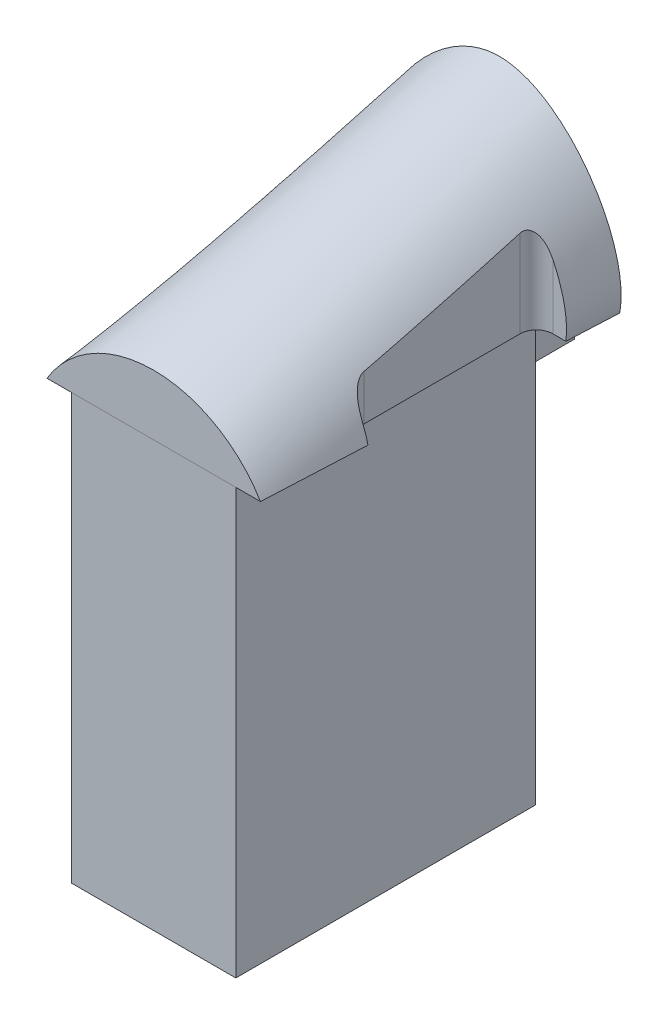
from build123d import *

# Parameters (mm, degrees)
SKETCH_1_W          = 40
SKETCH_1_H          = 73
EXTRUDE_1_DEPTH     = 51.75
SKETCH_2_W          = 26.5
SKETCH_2_H          = 11
EXTRUDE_2_DEPTH     = 10.5
CUT_EXTRUDE_1_DEPTH = 118.658825115


with BuildPart() as part:
    # 草图1 → 凸台-拉伸1 (new, symmetric)
    with BuildSketch(Plane(origin=(0, 0, 0), x_dir=(1, 0, 0), z_dir=(0, 1, 0))):
        Rectangle(SKETCH_1_W, SKETCH_1_H)
    extrude(amount=EXTRUDE_1_DEPTH, both=True)

    # 草图2 → 凸台-拉伸2 (add)
    with BuildSketch(Plane(origin=(0, 0, -36.5), x_dir=(-1, 0, 0), z_dir=(0, 0, -1))):
        with Locations((-5.75, 46.25)):
            Rectangle(SKETCH_2_W, SKETCH_2_H)
    extrude(amount=EXTRUDE_2_DEPTH)


with BuildPart() as body_2:
    # 草图3 → 放样1 section 0
    with BuildSketch(Plane(origin=(0, 0, -47), x_dir=(-1, 0, 0), z_dir=(0, 0, -1))):
        with BuildLine():
            Line((-30, 51.75), (30, 51.75))
            add(Edge.make_bspline(
                [(-30, 51.75), (-32.960840364, 67.552970125), (-0.122307099, 116.257852524), (33.072086404, 64.936710937), (30, 51.75)],
                knots=[0, 0, 0, 0, 0.500504929, 1, 1, 1, 1], degree=3))
        make_face()
    # 草图4 for 放样1 → 放样1 section 1
    with BuildSketch(Plane.XY.offset(36.5)):
        with BuildLine():
            Line((-26, 51.75), (26, 51.75))
            # circular arc as an exact rational Bezier (weights 1, cos(half-angle), 1)
            Bezier((26, 51.75), (0, 95.0040341), (-26, 51.75), weights=[1, 0.515188813, 1])
        make_face()
    loft()

    # 草图5 → 切除-拉伸1 (cut, through all)
    with BuildSketch(Plane.XZ.offset(-51.75)):
        with BuildLine():
            Line((-27.341317365, 11.5), (-26.243023445, 11.5))
            ThreePointArc((-26.243023445, 11.5), (-23.41459632, 10.328427125), (-22.243023445, 7.5))
            Line((-22.243023445, 7.5), (-22.243023445, -30.5))
            ThreePointArc((-22.243023445, -30.5), (-23.41459632, -33.328427125), (-26.243023445, -34.5))
            Line((-26.243023445, -34.5), (-29.401197605, -34.5))
            Line((-29.401197605, -34.5), (-36.989276173, -34.5))
            Line((-36.989276173, -34.5), (-36.989276173, 12.347472548))
            Line((-36.989276173, 12.347472548), (-27.341317365, 11.5))
        make_face()
        with BuildLine():
            Line((36.989276173, 12.347472548), (27.341317365, 11.5))
            Line((27.341317365, 11.5), (26.243023445, 11.5))
            ThreePointArc((26.243023445, 11.5), (23.41459632, 10.328427125), (22.243023445, 7.5))
            Line((22.243023445, 7.5), (22.243023445, -30.5))
            ThreePointArc((22.243023445, -30.5), (23.41459632, -33.328427125), (26.243023445, -34.5))
            Line((26.243023445, -34.5), (29.401197605, -34.5))
            Line((29.401197605, -34.5), (36.989276173, -34.5))
            Line((36.989276173, -34.5), (36.989276173, 12.347472548))
        make_face()
    extrude(amount=-CUT_EXTRUDE_1_DEPTH, mode=Mode.SUBTRACT)


solid = Compound([part.part, body_2.part])
